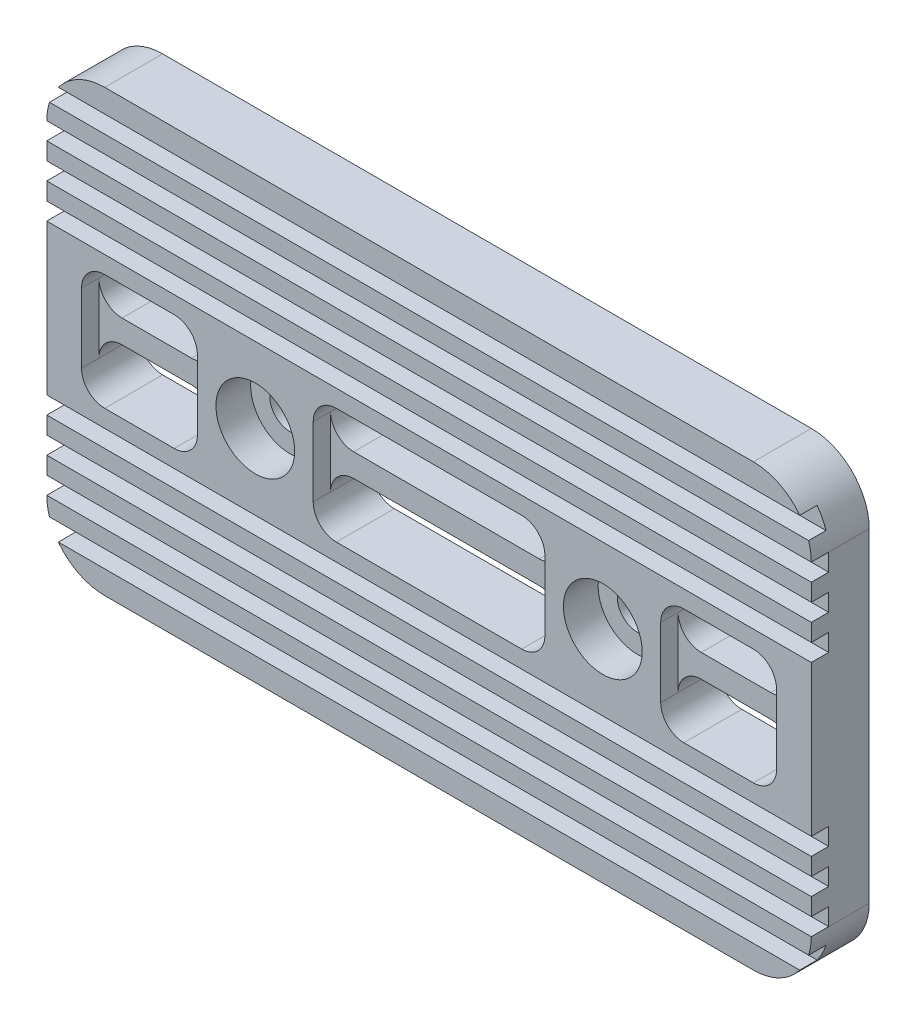
from build123d import *

# Parameters (mm, degrees)
SKETCH_1_W          = 66
SKETCH_1_H          = 38
SKETCH_1_R          = 1.75
EXTRUDE_1_DEPTH     = 5
SKETCH_2_R          = 3.4
CUT_EXTRUDE_1_DEPTH = 3
SKETCH_3_W          = 1.5
SKETCH_3_H          = 1.5
CUT_EXTRUDE_2_DEPTH = 73
SKETCH_4_W          = 10
SKETCH_4_H          = 1.5
SKETCH_4_W_2        = 20
CUT_EXTRUDE_3_DEPTH = 1.5
FILLET_1_R          = 5
SKETCH_5_W          = 13
SKETCH_5_H          = 1.5
CUT_EXTRUDE_4_DEPTH = 1.5
SKETCH_6_W          = 20
SKETCH_6_H          = 10
SKETCH_6_W_2        = 10
CUT_EXTRUDE_5_DEPTH = 11.5
FILLET_2_R          = 2
SKETCH_7_W          = 10
SKETCH_7_H          = 2
SKETCH_7_W_2        = 20
EXTRUDE_2_DEPTH     = 5
SKETCH_8_W          = 10
SKETCH_8_H          = 2
SKETCH_8_W_2        = 20
CUT_EXTRUDE_6_DEPTH = 1.5
FILLET_3_R          = 2
SCALE_1_SCALE       = 0.6


with BuildPart() as part:
    # 草图1 → 凸台-拉伸1 (new body)
    with BuildSketch(Plane.XY):
        Rectangle(SKETCH_1_W, SKETCH_1_H)
        with Locations((-15, 0)):
            Circle(SKETCH_1_R, mode=Mode.SUBTRACT)
        with Locations(Location((15, 0, 0), (0, 0, 180))):
            Circle(SKETCH_1_R, mode=Mode.SUBTRACT)
    extrude(amount=EXTRUDE_1_DEPTH)

    # 草图2 → 切除-拉伸1 (cut)
    with BuildSketch(Plane.XY.offset(5)):
        with Locations((-15, 0)):
            Circle(SKETCH_2_R)
        with Locations((15, 0)):
            Circle(SKETCH_2_R)
    extrude(amount=-CUT_EXTRUDE_1_DEPTH, mode=Mode.SUBTRACT)

    # 草图3 → 切除-拉伸2 (cut)
    with BuildSketch(Plane.ZY.offset(33)):
        with Locations((4.25, 16.25)):
            Rectangle(SKETCH_3_W, SKETCH_3_H)
        with Locations((4.25, 13.25)):
            Rectangle(SKETCH_3_W, SKETCH_3_H)
        with Locations((4.25, 10.25)):
            Rectangle(SKETCH_3_W, SKETCH_3_H)
        with Locations((4.25, -10.25)):
            Rectangle(SKETCH_3_W, SKETCH_3_H)
        with Locations((4.25, -13.25)):
            Rectangle(SKETCH_3_W, SKETCH_3_H)
        with Locations((4.25, -16.25)):
            Rectangle(SKETCH_3_W, SKETCH_3_H)
    extrude(amount=-CUT_EXTRUDE_2_DEPTH, mode=Mode.SUBTRACT)

    # 草图4 → 切除-拉伸3 (cut)
    with BuildSketch(Plane.XY.offset(5)):
        with Locations((-28, 7.25)):
            Rectangle(SKETCH_4_W, SKETCH_4_H)
        with Locations((-28, -7.25)):
            Rectangle(SKETCH_4_W, SKETCH_4_H)
        with Locations((0, 7.25)):
            Rectangle(SKETCH_4_W_2, SKETCH_4_H)
        with Locations((0, -7.25)):
            Rectangle(SKETCH_4_W_2, SKETCH_4_H)
        with Locations((28, -7.25)):
            Rectangle(SKETCH_4_W, SKETCH_4_H)
        with Locations((28, 7.25)):
            Rectangle(SKETCH_4_W, SKETCH_4_H)
    extrude(amount=-CUT_EXTRUDE_3_DEPTH, mode=Mode.SUBTRACT)

    # 圆角1
    fillet_1_edges = [part.edges().sort_by_distance(p)[0] for p in [
        (33, -19, 2.5),
        (-33, -19, 2.5),
        (33, 19, 2.5),
        (-33, 19, 2.5),
    ]]
    fillet(fillet_1_edges, radius=FILLET_1_R - 0.0001)  # a hair under: the kernel refuses the full size

    # 草图5 → 切除-拉伸4 (cut)
    with BuildSketch(Plane.XY.offset(5)):
        with Locations((-16.5, 7.25)):
            Rectangle(SKETCH_5_W, SKETCH_5_H)
        with Locations((16.5, 7.25)):
            Rectangle(SKETCH_5_W, SKETCH_5_H)
        with Locations((-16.5, -7.25)):
            Rectangle(SKETCH_5_W, SKETCH_5_H)
        with Locations((16.5, -7.25)):
            Rectangle(SKETCH_5_W, SKETCH_5_H)
    extrude(amount=-CUT_EXTRUDE_4_DEPTH, mode=Mode.SUBTRACT)

    # 草图6 → 切除-拉伸5 (cut)
    with BuildSketch(Plane.XY.offset(5)):
        Rectangle(SKETCH_6_W, SKETCH_6_H)
        with Locations((25, 0)):
            Rectangle(SKETCH_6_W_2, SKETCH_6_H)
        with Locations((-25, 0)):
            Rectangle(SKETCH_6_W_2, SKETCH_6_H)
    extrude(amount=-CUT_EXTRUDE_5_DEPTH, mode=Mode.SUBTRACT)

    # 圆角2
    fillet_2_edges = [part.edges().sort_by_distance(p)[0] for p in [
        (-30, 5, 2.5),
        (-20, 5, 2.5),
        (-20, -5, 2.5),
        (-30, -5, 2.5),
        (20, -5, 2.5),
        (20, 5, 2.5),
        (30, 5, 2.5),
        (30, -5, 2.5),
        (-10, -5, 2.5),
        (-10, 5, 2.5),
        (10, 5, 2.5),
        (10, -5, 2.5),
    ]]
    fillet(fillet_2_edges, radius=FILLET_2_R)

    # 草图7 → 凸台-拉伸2 (add)
    with BuildSketch(Plane.XY.offset(5)):
        with Locations((-25, 0)):
            Rectangle(SKETCH_7_W, SKETCH_7_H)
        Rectangle(SKETCH_7_W_2, SKETCH_7_H)
        with Locations((25, 0)):
            Rectangle(SKETCH_7_W, SKETCH_7_H)
    extrude(amount=-EXTRUDE_2_DEPTH)

    # 草图8 → 切除-拉伸6 (cut)
    with BuildSketch(Plane.XY.offset(5)):
        with Locations((-25, 0)):
            Rectangle(SKETCH_8_W, SKETCH_8_H)
        Rectangle(SKETCH_8_W_2, SKETCH_8_H)
        with Locations((25, 0)):
            Rectangle(SKETCH_8_W, SKETCH_8_H)
    extrude(amount=-CUT_EXTRUDE_6_DEPTH, mode=Mode.SUBTRACT)

    # 圆角3
    fillet_3_edges = [part.edges().sort_by_distance(p)[0] for p in [
        (30, -1, 1.75),
        (30, 1, 1.75),
        (20, -1, 1.75),
        (20, 1, 1.75),
        (10, -1, 1.75),
        (10, 1, 1.75),
        (-10, -1, 1.75),
        (-10, 1, 1.75),
        (-30, -1, 1.75),
        (-20, -1, 1.75),
        (-20, 1, 1.75),
        (-30, 1, 1.75),
    ]]
    fillet(fillet_3_edges, radius=FILLET_3_R - 0.0001)  # a hair under: the kernel refuses the full size


with BuildPart() as part_1:
    # 缩放比例1: scaled about (0, 0, 0)
    add(part.part.scale(SCALE_1_SCALE))


solid = part_1.part
